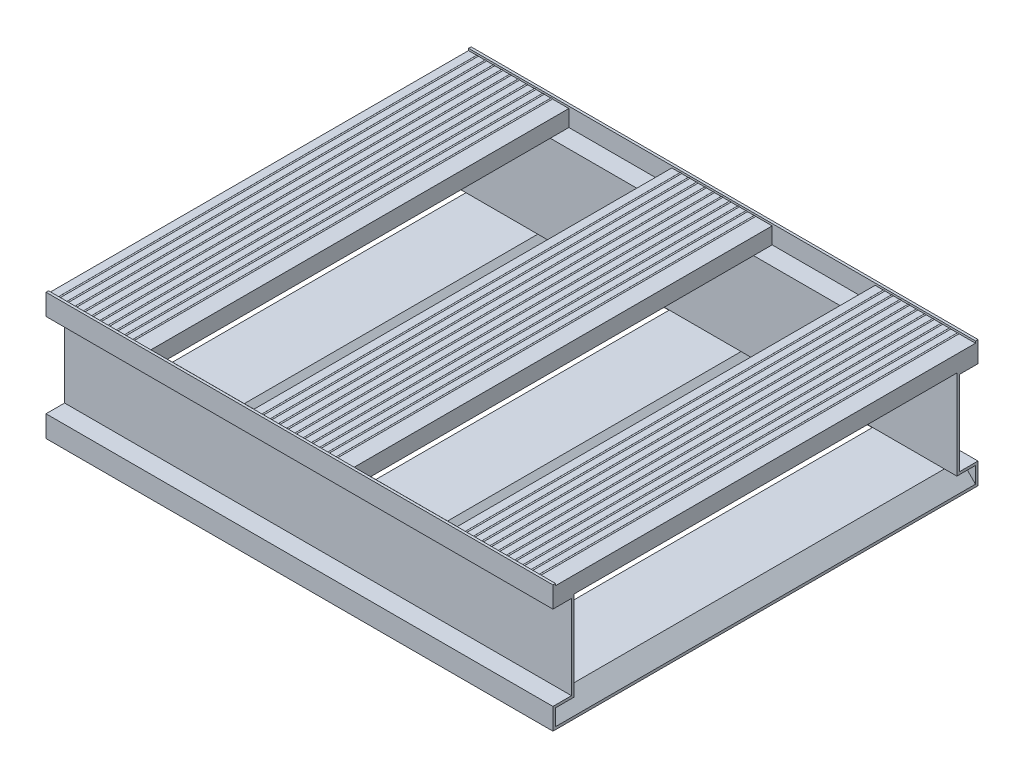
from build123d import *

# Parameters (mm, degrees)
BOSS_EXTRUDE1_DEPTH   = 255.5875
BOSS_EXTRUDE1_2_DEPTH = 255.5875
BOSS_EXTRUDE1_3_DEPTH = 255.5875
SKETCH4_W             = 120.65
SKETCH4_H             = 19.812
BOSS_EXTRUDE2_DEPTH   = 255.5875
SKETCH5_R             = 1.524
BOSS_EXTRUDE3_DEPTH   = 511.175
SKETCH_PATTERN1_START = -255.5875
SKETCH_PATTERN1_DEPTH = 511.175
BOSS_EXTRUDE4_DEPTH   = 304.8


# Read off the part's stored shape, not the designer's step: Sketch-Pattern1
with BuildPart() as part:
    # Sketch3 → Boss-Extrude1 (new, symmetric)
    with BuildSketch(Plane.XY):
        Polygon((-304.8, -76.2), (-304.8, -73.025), (-287.655, -55.5625), (-201.295, -55.5625), (-184.15, -73.025), (-184.15, -76.2), align=None)
    extrude(amount=BOSS_EXTRUDE1_DEPTH, both=True)



with BuildPart() as body_2:
    # Sketch3 → Boss-Extrude1 2 (new, symmetric)
    with BuildSketch(Plane.XY):
        Polygon((184.15, -73.025), (184.15, -76.2), (304.8, -76.2), (304.8, -73.025), (287.655, -55.5625), (201.295, -55.5625), align=None)
    extrude(amount=BOSS_EXTRUDE1_2_DEPTH, both=True)


with BuildPart() as body_3:
    # Sketch3 → Boss-Extrude1 3 (new, symmetric)
    with BuildSketch(Plane.XY):
        Polygon((-43.18, -55.5625), (43.18, -55.5625), (60.325, -73.025), (60.325, -76.2), (-60.325, -76.2), (-60.325, -73.025), align=None)
    extrude(amount=BOSS_EXTRUDE1_3_DEPTH, both=True)


with BuildPart() as body_4:
    # Sketch4 → Boss-Extrude2 (new, symmetric)
    with BuildSketch(Plane.XY):
        with Locations((-244.475, 63.881)):
            Rectangle(SKETCH4_W, SKETCH4_H)
    extrude(amount=BOSS_EXTRUDE2_DEPTH, both=True)

    # Sketch5 → Boss-Extrude3 (add)
    with BuildSketch(Plane.XY.offset(255.5875)):
        with Locations((-294.005, 72.644)):
            Circle(SKETCH5_R)
        with Locations((-284.099, 72.644)):
            Circle(SKETCH5_R)
        with Locations((-274.193, 72.644)):
            Circle(SKETCH5_R)
        with Locations((-264.287, 72.644)):
            Circle(SKETCH5_R)
        with Locations((-254.381, 72.644)):
            Circle(SKETCH5_R)
        with Locations((-244.475, 72.644)):
            Circle(SKETCH5_R)
        with Locations((-234.569, 72.644)):
            Circle(SKETCH5_R)
        with Locations((-224.663, 72.644)):
            Circle(SKETCH5_R)
        with Locations((-214.757, 72.644)):
            Circle(SKETCH5_R)
        with Locations((-204.851, 72.644)):
            Circle(SKETCH5_R)
    extrude(amount=-BOSS_EXTRUDE3_DEPTH)


with BuildPart() as body_5:
    # Sketch-Pattern1 outline → Sketch-Pattern1 (new body)
    with BuildSketch(Plane.XY.offset(SKETCH_PATTERN1_START)):
        with BuildLine():
            Line((60.325, 73.787), (40.63203125, 73.787))
            ThreePointArc((40.63203125, 73.787), (39.624, 74.168), (38.61596875, 73.787))
            Line((38.61596875, 73.787), (30.72603125, 73.787))
            ThreePointArc((30.72603125, 73.787), (29.718, 74.168), (28.70996875, 73.787))
            Line((28.70996875, 73.787), (20.82003125, 73.787))
            ThreePointArc((20.82003125, 73.787), (19.812, 74.168), (18.80396875, 73.787))
            Line((18.80396875, 73.787), (10.91403125, 73.787))
            ThreePointArc((10.91403125, 73.787), (9.906, 74.168), (8.89796875, 73.787))
            Line((8.89796875, 73.787), (1.00803125, 73.787))
            ThreePointArc((1.00803125, 73.787), (0, 74.168), (-1.00803125, 73.787))
            Line((-1.00803125, 73.787), (-8.89796875, 73.787))
            ThreePointArc((-8.89796875, 73.787), (-9.906, 74.168), (-10.91403125, 73.787))
            Line((-10.91403125, 73.787), (-18.80396875, 73.787))
            ThreePointArc((-18.80396875, 73.787), (-19.812, 74.168), (-20.82003125, 73.787))
            Line((-20.82003125, 73.787), (-28.70996875, 73.787))
            ThreePointArc((-28.70996875, 73.787), (-29.718, 74.168), (-30.72603125, 73.787))
            Line((-30.72603125, 73.787), (-38.61596875, 73.787))
            ThreePointArc((-38.61596875, 73.787), (-39.624, 74.168), (-40.63203125, 73.787))
            Line((-40.63203125, 73.787), (-48.52196875, 73.787))
            ThreePointArc((-48.52196875, 73.787), (-49.53, 74.168), (-50.53803125, 73.787))
            Line((-50.53803125, 73.787), (-60.325, 73.787))
            Line((-60.325, 73.787), (-60.325, 53.975))
            Line((-60.325, 53.975), (60.325, 53.975))
            Line((60.325, 53.975), (60.325, 73.787))
        make_face()
        with BuildLine():
            Line((304.8, 73.787), (285.10703125, 73.787))
            ThreePointArc((285.10703125, 73.787), (284.099, 74.168), (283.09096875, 73.787))
            Line((283.09096875, 73.787), (275.20103125, 73.787))
            ThreePointArc((275.20103125, 73.787), (274.193, 74.168), (273.18496875, 73.787))
            Line((273.18496875, 73.787), (265.29503125, 73.787))
            ThreePointArc((265.29503125, 73.787), (264.287, 74.168), (263.27896875, 73.787))
            Line((263.27896875, 73.787), (255.38903125, 73.787))
            ThreePointArc((255.38903125, 73.787), (254.381, 74.168), (253.37296875, 73.787))
            Line((253.37296875, 73.787), (245.48303125, 73.787))
            ThreePointArc((245.48303125, 73.787), (244.475, 74.168), (243.46696875, 73.787))
            Line((243.46696875, 73.787), (235.57703125, 73.787))
            ThreePointArc((235.57703125, 73.787), (234.569, 74.168), (233.56096875, 73.787))
            Line((233.56096875, 73.787), (225.67103125, 73.787))
            ThreePointArc((225.67103125, 73.787), (224.663, 74.168), (223.65496875, 73.787))
            Line((223.65496875, 73.787), (215.76503125, 73.787))
            ThreePointArc((215.76503125, 73.787), (214.757, 74.168), (213.74896875, 73.787))
            Line((213.74896875, 73.787), (205.85903125, 73.787))
            ThreePointArc((205.85903125, 73.787), (204.851, 74.168), (203.84296875, 73.787))
            Line((203.84296875, 73.787), (195.95303125, 73.787))
            ThreePointArc((195.95303125, 73.787), (194.945, 74.168), (193.93696875, 73.787))
            Line((193.93696875, 73.787), (184.15, 73.787))
            Line((184.15, 73.787), (184.15, 53.975))
            Line((184.15, 53.975), (304.8, 53.975))
            Line((304.8, 53.975), (304.8, 73.787))
        make_face()
    extrude(amount=SKETCH_PATTERN1_DEPTH)


with BuildPart() as part_1:
    add(part.part)

    add(body_2.part)  # Boss-Extrude4 merges body 2

    add(body_3.part)  # Boss-Extrude4 merges body 3

    add(body_4.part)  # Boss-Extrude4 merges body 4

    add(body_5.part)  # Boss-Extrude4 merges body 5
    # Sketch8 → Boss-Extrude4 (add, symmetric)
    with BuildSketch(Plane(origin=(0, 0, 0), x_dir=(0, 0, -1), z_dir=(1, 0, 0))):
        Polygon((-255.5875, -76.2), (-255.5875, -50.3809), (-233.2355, -50.3809), (-233.2355, 50.927), (-255.5875, 50.927), (-255.5875, 76.2), (-252.5395, 76.2), (-252.5395, 53.975), (-230.1875, 53.975), (-230.1875, -53.4289), (-252.5395, -53.4289), (-252.5395, -76.2), align=None)
        Polygon((252.5395, -53.4289), (252.5395, -76.2), (255.5875, -76.2), (255.5875, -50.3809), (233.2355, -50.3809), (233.2355, 50.927), (255.5875, 50.927), (255.5875, 76.2), (252.5395, 76.2), (252.5395, 53.975), (230.1875, 53.975), (230.1875, -53.4289), align=None)
    extrude(amount=BOSS_EXTRUDE4_DEPTH, both=True)


solid = part_1.part
